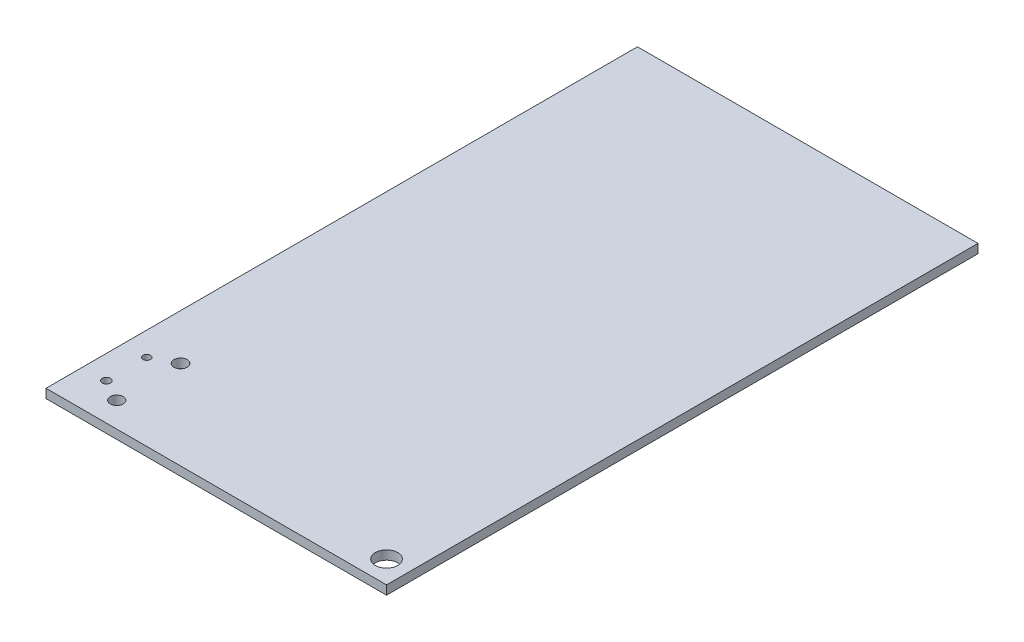
from build123d import *

# Parameters (mm, degrees)
SKETCH1_W           = 38
SKETCH1_H           = 66
BOSS_EXTRUDE1_DEPTH = 1
SKETCH2_R           = 1.25
CUT_EXTRUDE1_DEPTH  = 77.164296097
SKETCH3_R           = 0.456831937
SKETCH3_R_2         = 0.409961783
SKETCH3_R_3         = 0.739914173
SKETCH3_R_4         = 0.716276255
CUT_EXTRUDE2_DEPTH  = 77.164296097


with BuildPart() as part:
    # Sketch1 → Boss-Extrude1 (new body)
    with BuildSketch(Plane(origin=(0, 0, 0), x_dir=(1, 0, 0), z_dir=(0, 1, 0))):
        with Locations((19, 33)):
            Rectangle(SKETCH1_W, SKETCH1_H)
    extrude(amount=BOSS_EXTRUDE1_DEPTH)

    # Sketch2 → Cut-Extrude1 (cut, through all)
    with BuildSketch(Plane(origin=(0, 1, 0), x_dir=(1, 0, 0), z_dir=(0, 1, 0))):
        with Locations((35.5, 2.5)):
            Circle(SKETCH2_R)
    extrude(amount=-CUT_EXTRUDE1_DEPTH, mode=Mode.SUBTRACT)

    # Sketch3 → Cut-Extrude2 (cut, through all)
    with BuildSketch(Plane(origin=(0, 1, 0), x_dir=(1, 0, 0), z_dir=(0, 1, 0))):
        with Locations((2.638016887, 4.098772659)):
            Circle(SKETCH3_R)
        with Locations((2.638016887, 8.613282996)):
            Circle(SKETCH3_R_2)
        with Locations((5.107560434, 9.90998851)):
            Circle(SKETCH3_R_3)
        with Locations((5.107560434, 2.785166116)):
            Circle(SKETCH3_R_4)
    extrude(amount=-CUT_EXTRUDE2_DEPTH, mode=Mode.SUBTRACT)


solid = part.part
